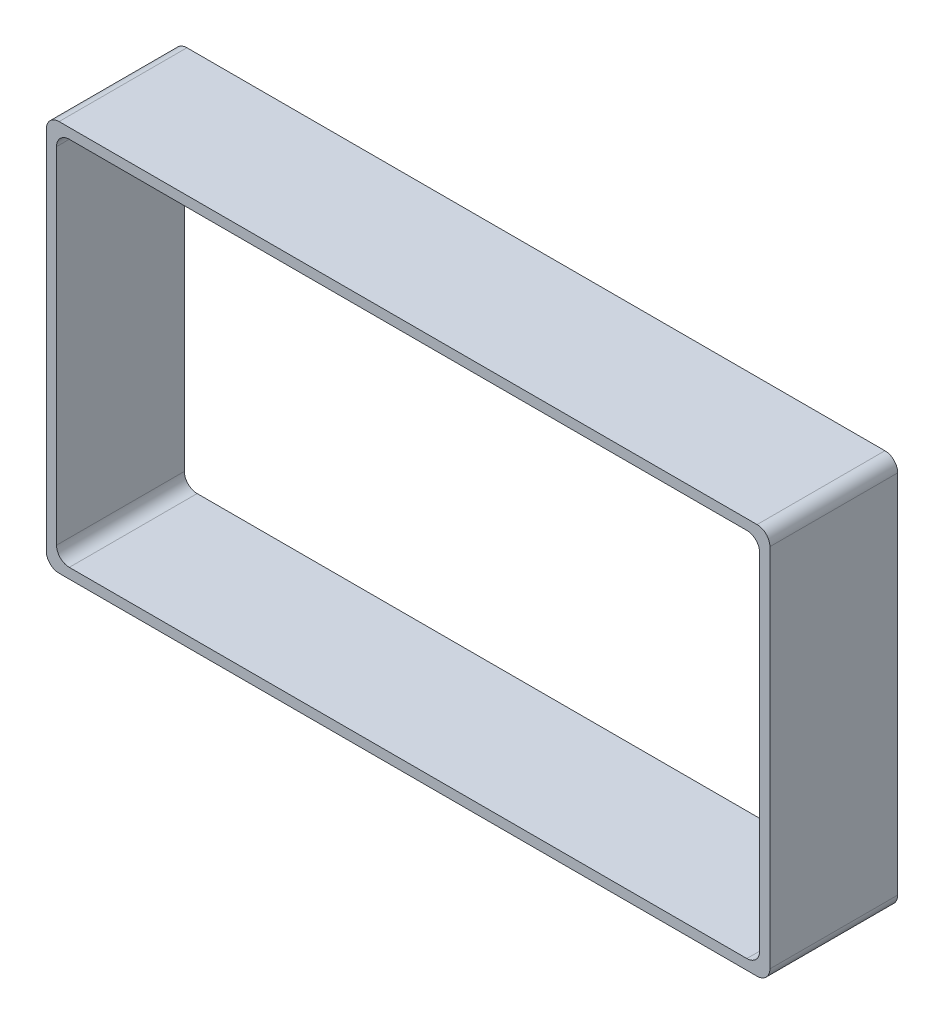
from build123d import *

# Parameters (mm, degrees)
ESQUISSE1_W        = 56.6
ESQUISSE1_H        = 30.6
ESQUISSE1_W_2      = 55
ESQUISSE1_H_2      = 29
BOSS_EXTRU_1_DEPTH = 10
CONG_1_R           = 1


with BuildPart() as part:
    # Esquisse1 → Boss.-Extru.1 (new body)
    with BuildSketch(Plane.XY):
        Rectangle(ESQUISSE1_W, ESQUISSE1_H)
        Rectangle(ESQUISSE1_W_2, ESQUISSE1_H_2, mode=Mode.SUBTRACT)
    extrude(amount=BOSS_EXTRU_1_DEPTH)

    # Congé1
    cong_1_edges = [part.edges().sort_by_distance(p)[0] for p in [
        (-27.5, 14.5, 5),
        (-27.5, -14.5, 5),
        (27.5, -14.5, 5),
        (27.5, 14.5, 5),
        (28.3, -15.3, 5),
        (-28.3, -15.3, 5),
        (-28.3, 15.3, 5),
        (28.3, 15.3, 5),
    ]]
    fillet(cong_1_edges, radius=CONG_1_R)


solid = part.part
